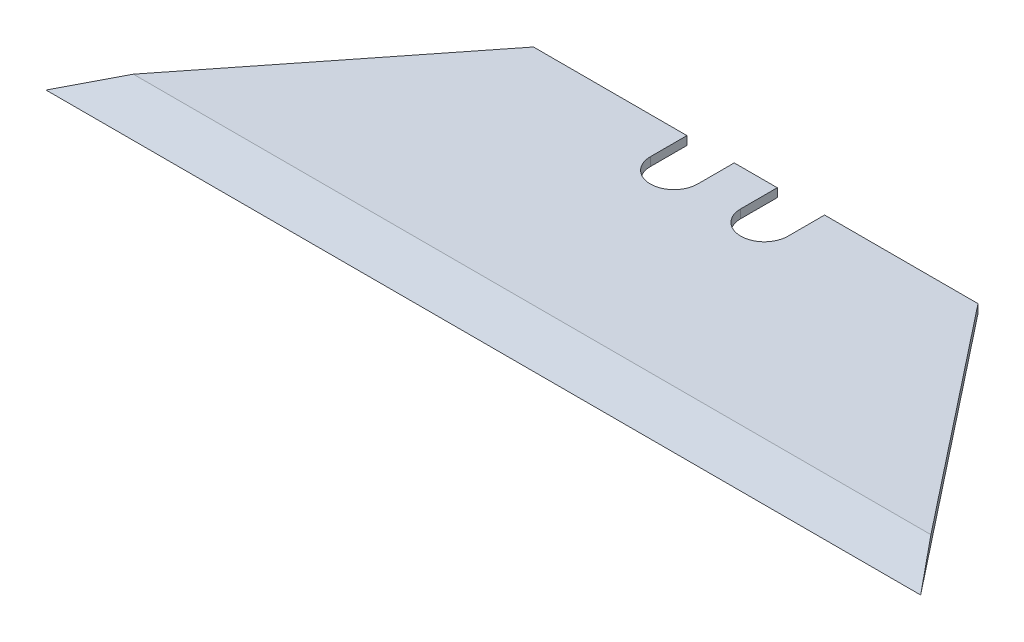
from build123d import *

# Parameters (mm, degrees)
BOSS_EXTRUDE1_DEPTH     = 0.6
CHAMFER1_SIZE           = 0.6
CHAMFER1_SIZE_2         = 3.402769092
CUT_EXTRUDE1_DEPTH      = 64.893348637
CUT_EXTRUDE1_DEPTH_BACK = 64.893348637


with BuildPart() as part:
    # Sketch1 → Boss-Extrude1 (new body)
    with BuildSketch(Plane(origin=(0, 0, 0), x_dir=(1, 0, 0), z_dir=(0, 1, 0))):
        Polygon((0, 0), (61, 0), (46, 19), (15, 19), align=None)
    extrude(amount=BOSS_EXTRUDE1_DEPTH)

    # Chamfer1
    # the kernel refuses this chamfer: 3.402769092, 0.6 mm, written as the material it takes off along each edge
    with BuildSketch(Plane(origin=(-8.8422275, 0.6, 0), x_dir=(0, -0.9776715712462579, 0.2101387607674348), z_dir=(1, 0, 0))) as chamfer1_piece_1:
        Polygon((CHAMFER1_SIZE * 0.977671571246, CHAMFER1_SIZE * 0.210138760767), (-CHAMFER1_SIZE_2 * 0.210138760753, CHAMFER1_SIZE_2 * 0.97767157118), (0, 0), align=None)
    extrude(amount=78.684455, mode=Mode.SUBTRACT)

    # Sketch2 → Cut-Extrude1 (cut, two sides: drawn at the far end of the back side and taken through both)
    with BuildSketch(Plane(origin=(0, 0.6, 0), x_dir=(1, 0, 0), z_dir=(0, 1, 0)).offset(-CUT_EXTRUDE1_DEPTH_BACK)):
        with BuildLine():
            Line((25.7, 16.450898266), (25.7, 22.487224665))
            ThreePointArc((25.7, 22.487224665), (27.35, 24.137224665), (29, 22.487224665))
            Line((29, 22.487224665), (29, 16.450898266))
            ThreePointArc((29, 16.450898266), (27.35, 14.800898266), (25.7, 16.450898266))
        make_face()
        with BuildLine():
            Line((32, 16.450898266), (32, 22.487224665))
            ThreePointArc((32, 22.487224665), (33.65, 24.137224665), (35.3, 22.487224665))
            Line((35.3, 22.487224665), (35.3, 16.450898266))
            ThreePointArc((35.3, 16.450898266), (33.65, 14.800898266), (32, 16.450898266))
        make_face()
    extrude(amount=CUT_EXTRUDE1_DEPTH + CUT_EXTRUDE1_DEPTH_BACK, mode=Mode.SUBTRACT)


solid = part.part
